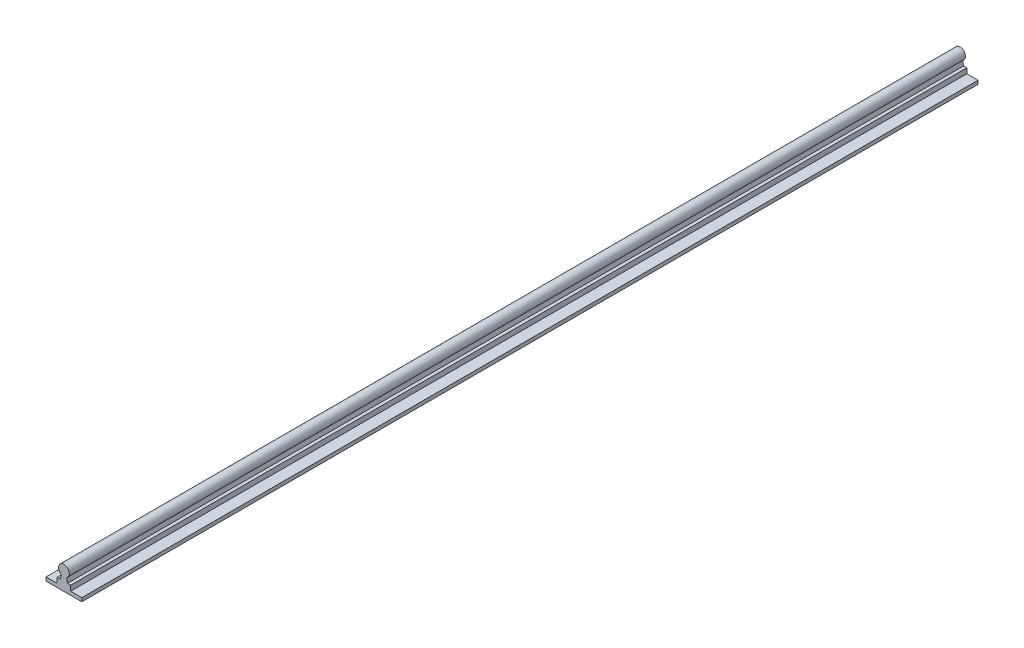
from build123d import *

# Parameters (mm, degrees)
BOSS_EXTRUDE1_DEPTH = 1000


with BuildPart() as part:
    # Sketch1 → Boss-Extrude1 (new body)
    with BuildSketch(Plane.XY):
        with BuildLine():
            Line((24.307457755, 0), (-15.692542245, 0))
            Line((-15.692542245, 0), (-15.692542245, 4))
            Line((-15.692542245, 4), (-3.192542245, 4))
            Line((-3.192542245, 4), (-3.192542245, 9.8))
            Line((-3.192542245, 9.8), (0.390557455, 9.8))
            Line((0.390557455, 9.8), (1.307457755, 15))
            ThreePointArc((1.307457755, 15), (4.307457755, 26.196152423), (7.307457755, 15))
            Line((7.307457755, 15), (8.224358055, 9.8))
            Line((8.224358055, 9.8), (11.807457755, 9.8))
            Line((11.807457755, 9.8), (11.807457755, 4))
            Line((11.807457755, 4), (24.307457755, 4))
            Line((24.307457755, 4), (24.307457755, 0))
        make_face()
    extrude(amount=BOSS_EXTRUDE1_DEPTH)


solid = part.part
